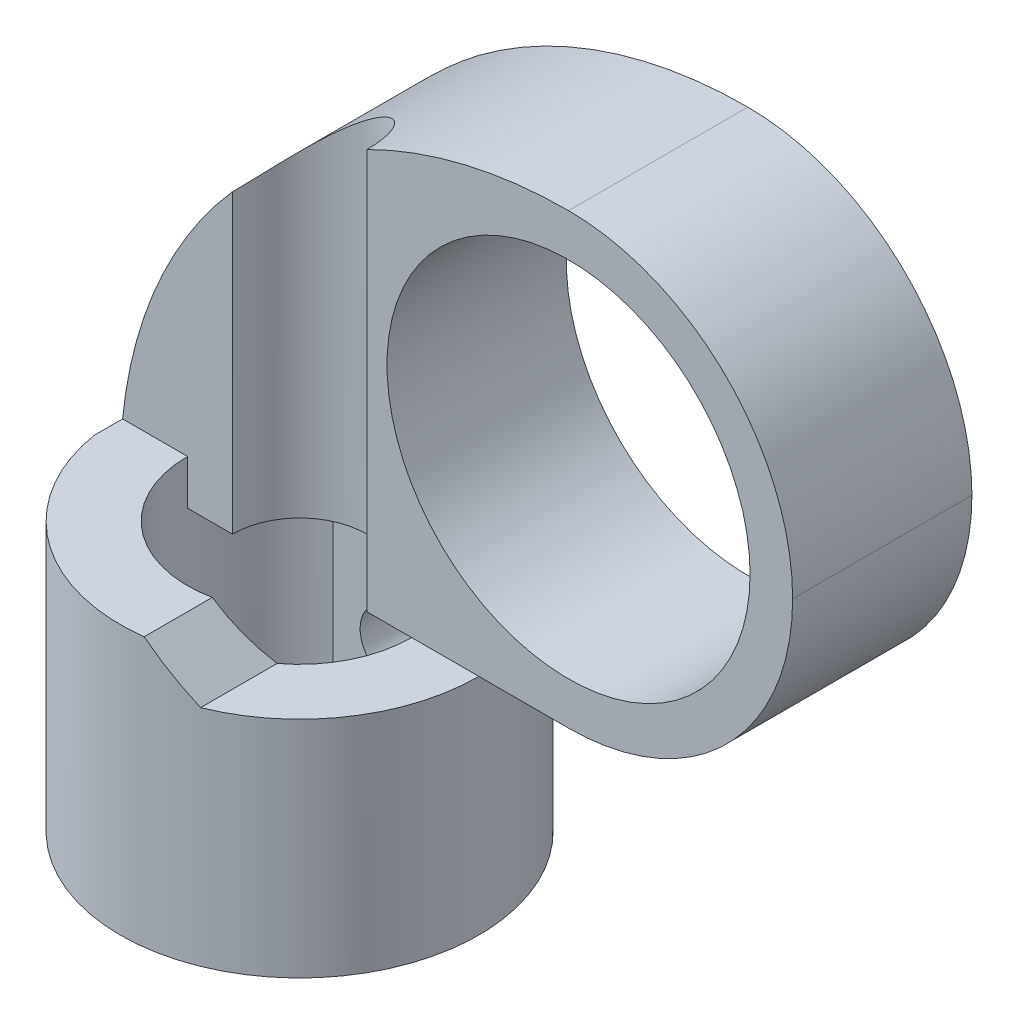
from build123d import *

# Parameters (mm, degrees)
SKETCH_1_R          = 4
EXTRUDE_1_DEPTH     = 6
CUT_EXTRUDE_1_DEPTH = 9.246211251
SKETCH_4_W          = 15
SKETCH_4_H          = 10
EXTRUDE_2_DEPTH     = 4
SKETCH_5_R          = 4.05
CUT_EXTRUDE_3_DEPTH = 20.02629759
FILLET_1_R          = 10
FILLET_2_R          = 5
CUT_EXTRUDE_4_DEPTH = 16.394804409
SKETCH_7_R          = 1.5
CUT_EXTRUDE_5_DEPTH = 20.02629769
SKETCH_8_R          = 0.75
CUT_EXTRUDE_7_DEPTH = 3
SKETCH_9_W          = 2.5
SKETCH_9_H          = 1
CUT_EXTRUDE_8_DEPTH = 20.02629769
CHAMFER_1_SIZE      = 1


# Some blends are built 0.0001 mm under size
with BuildPart() as part:
    # 草图1 → 凸台-拉伸1 (new body)
    with BuildSketch(Plane(origin=(0, 0, 0), x_dir=(1, 0, 0), z_dir=(0, 1, 0))):
        with Locations(Location((0, 0, 0), (0, 0, 270))):
            Circle(SKETCH_1_R)
    extrude(amount=EXTRUDE_1_DEPTH)

    # 草图2 → 切除-拉伸1 (cut, through all)
    with BuildSketch(Plane(origin=(0, 0, 0), x_dir=(1, 0, 0), z_dir=(0, 1, 0))):
        with BuildLine():
            Line((-1.356465997, 2.1), (1.356465997, 2.1))
            ThreePointArc((1.356465997, 2.1), (0, -2.5), (-1.356465997, 2.1))
        make_face()
    extrude(amount=CUT_EXTRUDE_1_DEPTH, mode=Mode.SUBTRACT)

    # 草图4 → 凸台-拉伸2 (add)
    with BuildSketch(Plane.XY.offset(-4)):
        with Locations((3.5, 10)):
            Rectangle(SKETCH_4_W, SKETCH_4_H)
    extrude(amount=EXTRUDE_2_DEPTH)

    # 草图5 → 切除-拉伸3 (cut, through all)
    with BuildSketch(Plane.XY):
        with Locations((6, 10)):
            Circle(SKETCH_5_R)
    extrude(amount=-CUT_EXTRUDE_3_DEPTH, mode=Mode.SUBTRACT)

    # 圆角1
    # the kernel refuses this fillet: 10 mm, written as the material it takes off along each edge
    with BuildSketch(Plane(origin=(-4, 15, -29), x_dir=(0, -1, 0), z_dir=(0, 0, 1))) as fillet_1_piece_1:
        with BuildLine():
            CenterArc((FILLET_1_R, FILLET_1_R), FILLET_1_R, 180, 90)
            Line((0, FILLET_1_R), (0, 0))
            Line((0, 0), (FILLET_1_R, 0))
        make_face()
    extrude(amount=54, mode=Mode.SUBTRACT)

    # 圆角2
    fillet_2_edges = [part.edges().sort_by_distance(p)[0] for p in [
        (11, 5, -2),
        (11, 15, -2),
    ]]
    fillet(fillet_2_edges, radius=FILLET_2_R - 0.0001)  # a hair under: the kernel refuses the full size

    # 草图6 → 切除-拉伸4 (cut, through all)
    with BuildSketch(Plane.XZ.offset(-5)):
        with BuildLine():
            Line((-4, -4), (-4, 0))
            ThreePointArc((-4, 0), (-2.828427125, -2.828427125), (0, -4))
            Line((0, -4), (-4, -4))
        make_face()
    extrude(amount=-CUT_EXTRUDE_4_DEPTH, mode=Mode.SUBTRACT)

    # 草图7 → 切除-拉伸5 (cut, through all)
    with BuildSketch(Plane.XZ):
        Circle(SKETCH_7_R)
    extrude(amount=-CUT_EXTRUDE_5_DEPTH, mode=Mode.SUBTRACT)

    # 草图8 → 切除-拉伸7 (cut)
    with BuildSketch(Plane.XY.offset(-4)):
        with Locations(Location((0, 2.5, 0), (0, 0, 270))):
            Circle(SKETCH_8_R)
    extrude(amount=CUT_EXTRUDE_7_DEPTH, mode=Mode.SUBTRACT)

    # 草图9 → 切除-拉伸8 (cut, through all)
    with BuildSketch(Plane.XY):
        with Locations((2.75, 5.5)):
            Rectangle(SKETCH_9_W, SKETCH_9_H)
    extrude(amount=CUT_EXTRUDE_8_DEPTH, mode=Mode.SUBTRACT)

    # 倒角1
    chamfer_1_edges = [part.edges().sort_by_distance(p)[0] for p in [
        (1.5, 6, 2.854049622),
    ]]
    chamfer(chamfer_1_edges, length=CHAMFER_1_SIZE - 0.0001)  # a hair under: the kernel refuses the full size


solid = part.part
